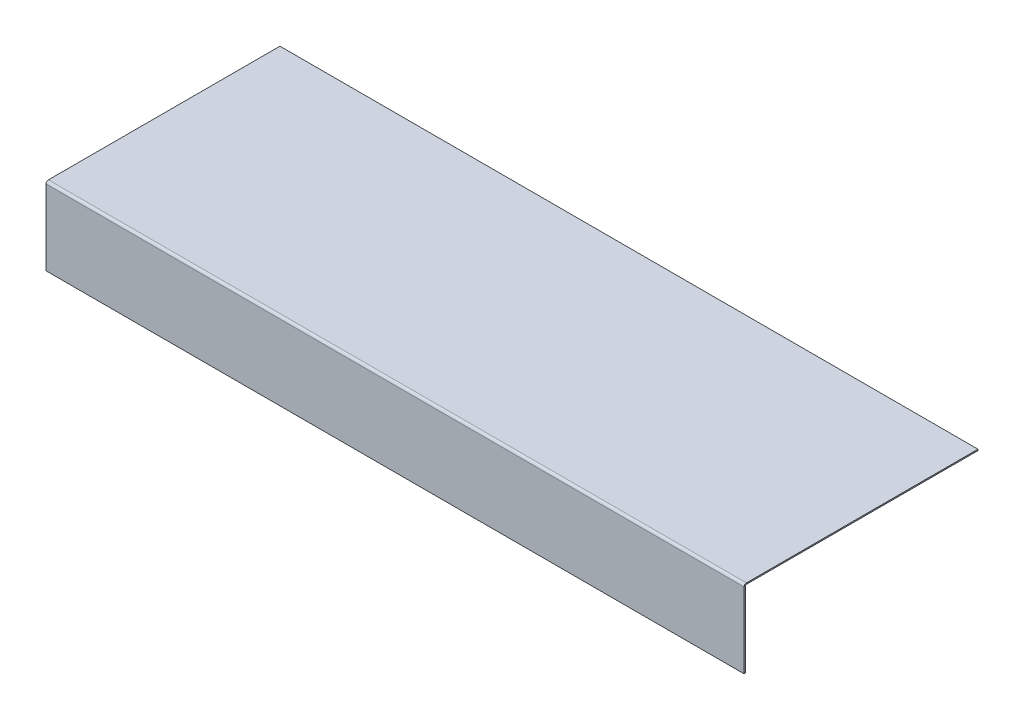
from build123d import *

# Parameters (mm, degrees)
SKETCH1_W                    = 457.2
SKETCH1_H                    = 152.4
BASE_FLANGE1_DEPTH           = 0.8128
EDGE_FLANGE1_STRIP_W         = 4.7244
EDGE_FLANGE1_STRIP_H         = 0.8128
EDGE_FLANGE1_STRIP_CUT_DEPTH = 457.2
EDGE_FLANGE1_DEPTH           = 457.2


# Sheet-metal steps are written as plain solids
with BuildPart() as part:
    # Sketch1 → Base-Flange1 (new body)
    with BuildSketch(Plane(origin=(0, 0, 0), x_dir=(1, 0, 0), z_dir=(0, 1, 0))):
        with Locations((0, -76.2)):
            Rectangle(SKETCH1_W, SKETCH1_H)
    extrude(amount=-BASE_FLANGE1_DEPTH)

    # Edge-Flange1 strip (across the edge) → Edge-Flange1 strip cut (cut)
    with BuildSketch(Plane(origin=(228.6, -0.8128, 152.4), x_dir=(0, 0, -1), z_dir=(-1, 0, 0))):
        with Locations((-1.6256, -0.4064)):
            Rectangle(EDGE_FLANGE1_STRIP_W, EDGE_FLANGE1_STRIP_H)
    extrude(amount=EDGE_FLANGE1_STRIP_CUT_DEPTH, mode=Mode.SUBTRACT)

    # Edge-Flange1 section (across the edge) → Edge-Flange1 (add)
    with BuildSketch(Plane(origin=(228.6, -0.8128, 152.4), x_dir=(0, 0, -1), z_dir=(-1, 0, 0))):
        with BuildLine():
            Line((-0.8128, 0.7366), (-0.8128, 49.9872))
            Line((-0.8128, 49.9872), (0, 49.9872))
            Line((0, 49.9872), (0, 0.7366))
            ThreePointArc((0, 0.7366), (0.215745145, 0.215745145), (0.7366, 0))
            Line((0.7366, 0), (0.7366, -0.8128))
            ThreePointArc((0.7366, -0.8128), (-0.358991247, -0.358991247), (-0.8128, 0.7366))
        make_face()
    extrude(amount=EDGE_FLANGE1_DEPTH)


solid = part.part
